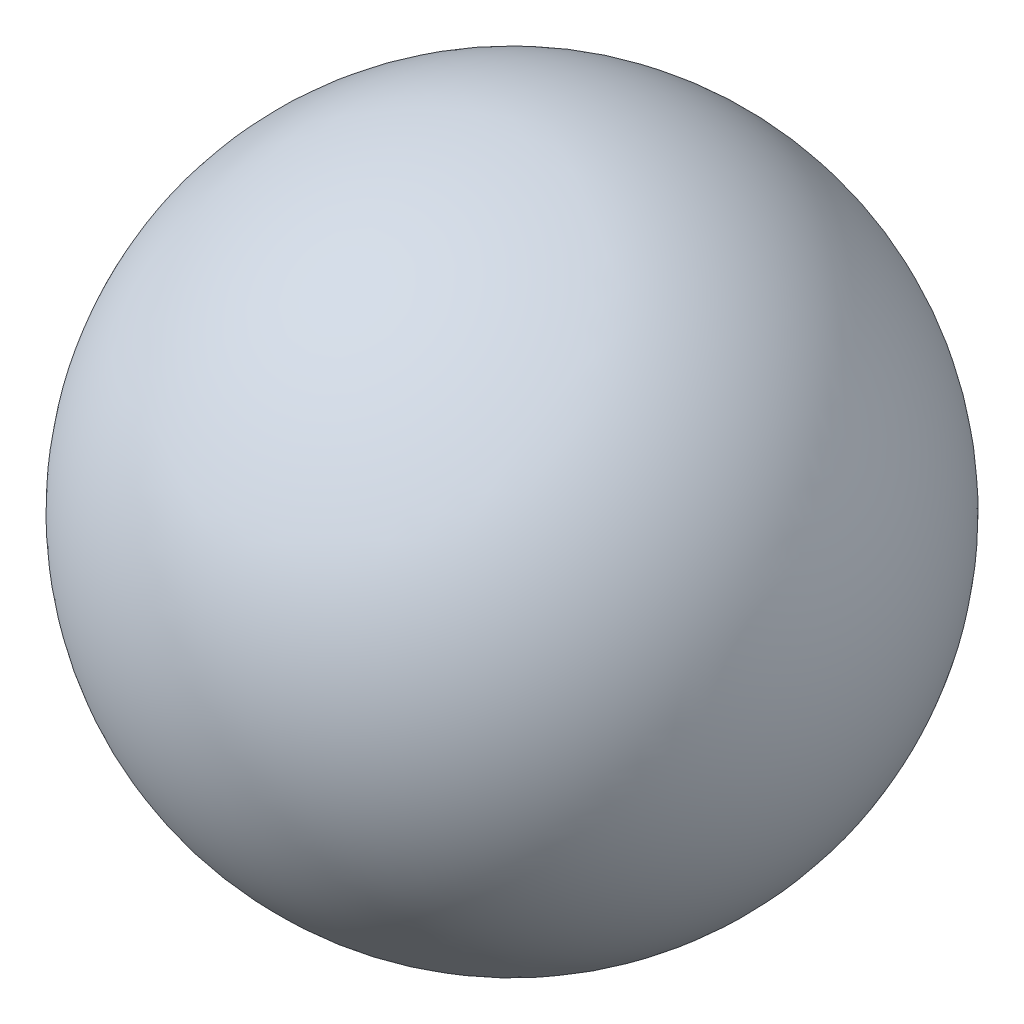
from build123d import *


with BuildPart() as part:
    # Sketch1 → Revolve2 (revolve)
    with BuildSketch(Plane(origin=(0, 0, 0), x_dir=(1, 0, 0), z_dir=(0, 1, 0))):
        with BuildLine():
            Line((20, 0), (-20, 0))
            ThreePointArc((-20, 0), (0, -20), (20, 0))
        make_face()
    revolve(axis=Axis((-20, 0, 0), (1, 0, 0)))


solid = part.part
